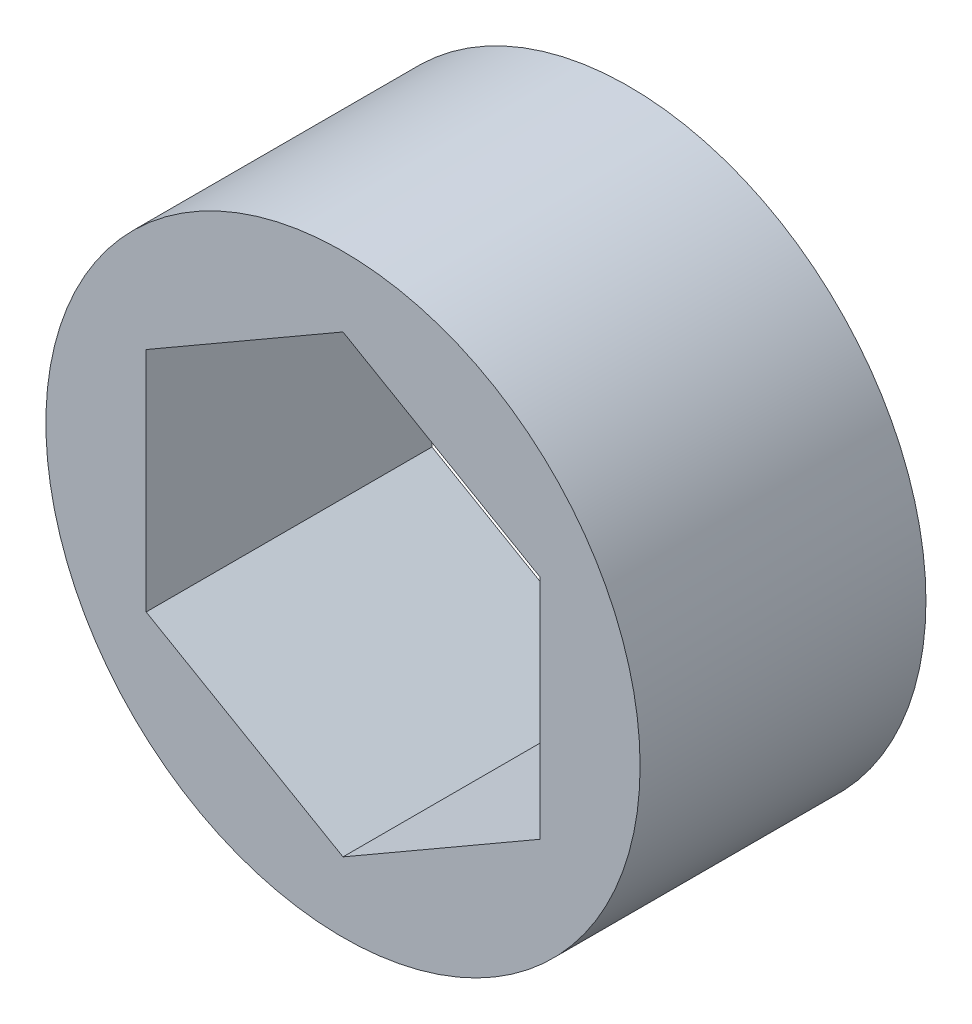
from build123d import *

# Parameters (mm, degrees)
SKETCH1_R           = 10.16
BOSS_EXTRUDE1_DEPTH = 9.77392


with BuildPart() as part:
    # Sketch1 → Boss-Extrude1 (new body)
    with BuildSketch(Plane.XY):
        Circle(SKETCH1_R)
        Polygon((6.731, 3.886144662), (0, 7.772289324), (-6.731, 3.886144662), (-6.731, -3.886144662), (0, -7.772289324), (6.731, -3.886144662), align=None, mode=Mode.SUBTRACT)
    extrude(amount=BOSS_EXTRUDE1_DEPTH)


solid = part.part
